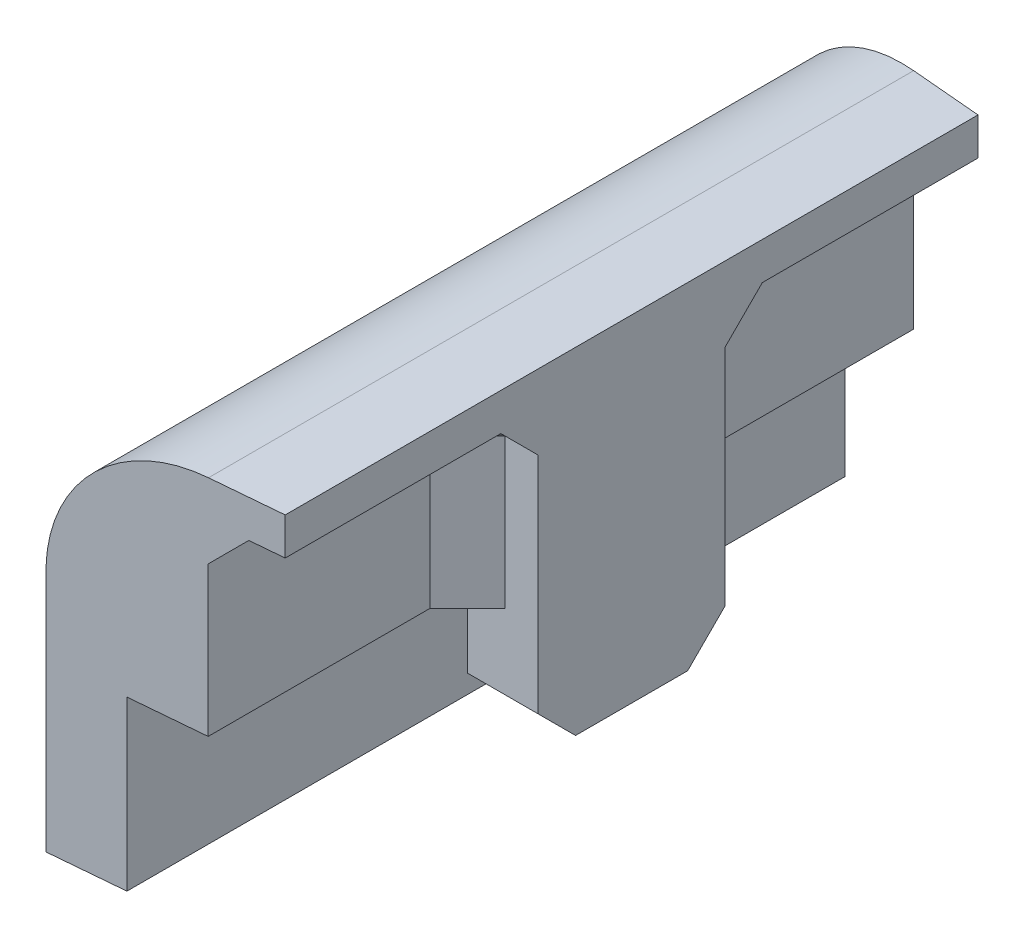
from build123d import *

# Parameters (mm, degrees)
BOSS_EXTRUDE1_START       = -62.152648455
BOSS_EXTRUDE1_DEPTH       = 62.152648455
BOSS_EXTRUDE1_START_2     = 33.419354119
BOSS_EXTRUDE1_2_OUTLINE_W = 41
BOSS_EXTRUDE1_2_OUTLINE_H = 70
BOSS_EXTRUDE1_2_DEPTH     = 4.580645881
SKETCH2_W                 = 31.75
SKETCH2_H                 = 50.8
BOSS_EXTRUDE2_DEPTH       = 12.035499154
CHAMFER1_SIZE             = 6.35


with BuildPart() as part:
    # Boss-Extrude1: read off the stored shape, not the designer's step
    # Boss-Extrude1 outline → Boss-Extrude1 (new body)
    with BuildSketch(Plane.XY.offset(BOSS_EXTRUDE1_START)):
        with BuildLine():
            Line((-301.612263914, 87.858595148), (-289.57676476, 87.858595148))
            Line((-289.57676476, 87.858595148), (-289.57676476, 94.208595148))
            Line((-289.57676476, 94.208595148), (-301.56393658, 94.208595148))
            ThreePointArc((-301.56393658, 94.208595148), (-319.524448822, 86.76910739), (-326.96393658, 68.808595148))
            Line((-326.96393658, 68.808595148), (-326.96393658, 27.533595148))
            Line((-326.96393658, 27.533595148), (-314.312263914, 27.533595148))
            Line((-314.312263914, 27.533595148), (-314.312263914, 56.108595148))
            Line((-314.312263914, 56.108595148), (-301.612263914, 56.108595148))
            Line((-301.612263914, 56.108595148), (-301.612263914, 87.858595148))
        make_face()
    boss_extrude1 = extrude(amount=BOSS_EXTRUDE1_DEPTH)

    # Boss-Extrude1 2 outline → Boss-Extrude1 2 (cut)
    with BuildSketch(Plane(origin=(0, 0, 0), x_dir=(0.9961946980917454, 0, 0.08715574274765814), z_dir=(0.08715574274765815, 0, -0.9961946980917455)).offset(BOSS_EXTRUDE1_START_2)):
        with Locations((-312.5, -61)):
            Rectangle(BOSS_EXTRUDE1_2_OUTLINE_W, BOSS_EXTRUDE1_2_OUTLINE_H)
    boss_extrude1_2 = extrude(amount=BOSS_EXTRUDE1_2_DEPTH, mode=Mode.SUBTRACT)

    # Mirror1: Boss-Extrude1, Boss-Extrude1 2 across plane
    add(boss_extrude1.mirror(Plane.XY))
    add(boss_extrude1_2.mirror(Plane.XY), mode=Mode.SUBTRACT)

    # Sketch2 → Boss-Extrude2 (add)
    with BuildSketch(Plane(origin=(-301.612263914, 0, 0), x_dir=(0, 0, -1), z_dir=(1, 0, 0))):
        with Locations((0, 62.458595148)):
            Rectangle(SKETCH2_W, SKETCH2_H)
    extrude(amount=BOSS_EXTRUDE2_DEPTH)

    # Chamfer1
    chamfer1_edges = [part.edges().sort_by_distance(p)[0] for p in [
        (-295.594514337, 37.058595148, -15.875),
        (-295.594514337, 37.058595148, 15.875),
        (-295.594514337, 87.858595148, 15.875),
        (-301.612263914, 87.858595148, 37.904832248),
        (-301.612263914, 71.983595148, 15.875),
        (-295.594514337, 87.858595148, -15.875),
        (-301.612263914, 71.983595148, -15.875),
        (-301.612263914, 87.858595148, -37.904832248),
    ]]
    chamfer(chamfer1_edges, length=CHAMFER1_SIZE)


solid = part.part
